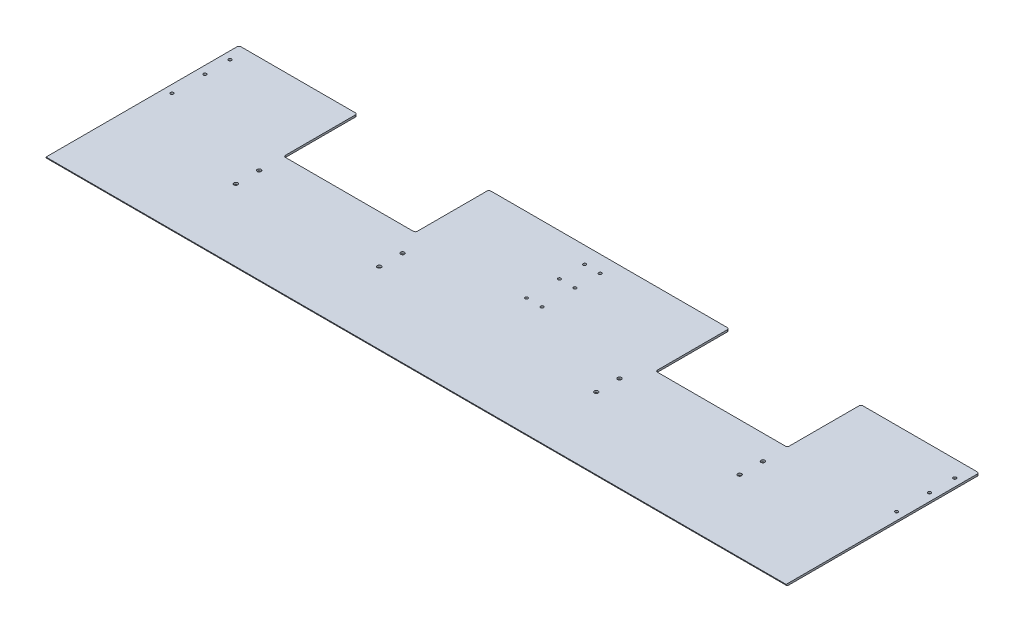
from build123d import *

# Parameters (mm, degrees)
SKETCH1_W                    = 1212.85
SKETCH1_H                    = 316.23
BOSS_EXTRUDE1_DEPTH          = 3.175
FILLET1_R                    = 3.175
SKETCH4_W                    = 215.9
SKETCH4_H                    = 120.65
CUT_EXTRUDE1_DEPTH           = 1254.402016922
FILLET2_R                    = 3.175
F_10_0_1935_DIAMETER_HOLE1_D = 4.9149
F_1_4_0_25_DIAMETER_HOLE1_D  = 6.35


with BuildPart() as part:
    # Sketch1 → Boss-Extrude1 (new body)
    with BuildSketch(Plane(origin=(0, 0, 0), x_dir=(1, 0, 0), z_dir=(0, 1, 0))):
        with Locations((606.425, 158.115)):
            Rectangle(SKETCH1_W, SKETCH1_H)
    extrude(amount=BOSS_EXTRUDE1_DEPTH)

    # Fillet1
    fillet1_edges = [part.edges().sort_by_distance(p)[0] for p in [
        (606.425, 0, 0),
    ]]
    fillet(fillet1_edges, radius=FILLET1_R - 0.0001)  # a hair under: the kernel refuses the full size

    # Sketch4 → Cut-Extrude1 (cut, through all)
    with BuildSketch(Plane(origin=(0, 3.175, 0), x_dir=(1, 0, 0), z_dir=(0, 1, 0))):
        with Locations((301.625, 255.905)):
            Rectangle(SKETCH4_W, SKETCH4_H)
        with Locations((911.225, 255.905)):
            Rectangle(SKETCH4_W, SKETCH4_H)
    extrude(amount=-CUT_EXTRUDE1_DEPTH, mode=Mode.SUBTRACT)

    # Fillet2
    fillet2_edges = [part.edges().sort_by_distance(p)[0] for p in [
        (193.675, 1.5875, -195.58),
        (193.675, 1.5875, -316.23),
        (409.575, 1.5875, -316.23),
        (409.575, 1.5875, -195.58),
        (803.275, 1.5875, -316.23),
        (1019.175, 1.5875, -316.23),
        (1019.175, 1.5875, -195.58),
        (803.275, 1.5875, -195.58),
        (0, 1.5875, -316.23),
        (1212.85, 1.5875, -316.23),
    ]]
    fillet(fillet2_edges, radius=FILLET2_R)

    # #10 (0.1935) Diameter Hole1 (through all)
    with Locations(Plane(origin=(0, 3.175, 0), x_dir=(1, 0, 0), z_dir=(0, 1, 0))):
        with Locations((12.7, 193.675), (12.7, 247.65), (12.7, 288.925), (593.725, 193.675), (593.725, 247.65), (593.725, 288.925), (619.125, 288.925), (619.125, 247.65), (619.125, 193.675), (1200.15, 288.925), (1200.15, 247.65), (1200.15, 193.675)):
            Hole(F_10_0_1935_DIAMETER_HOLE1_D / 2)

    # 1/4 (0.25) Diameter Hole1 (through all)
    with Locations(Plane(origin=(0, 3.175, 0), x_dir=(1, 0, 0), z_dir=(0, 1, 0))):
        with Locations((193.675, 155.575), (193.675, 117.475), (428.625, 155.575), (428.625, 117.475), (784.225, 117.475), (784.225, 155.575), (1019.175, 117.475), (1019.175, 155.575)):
            Hole(F_1_4_0_25_DIAMETER_HOLE1_D / 2)


solid = part.part
